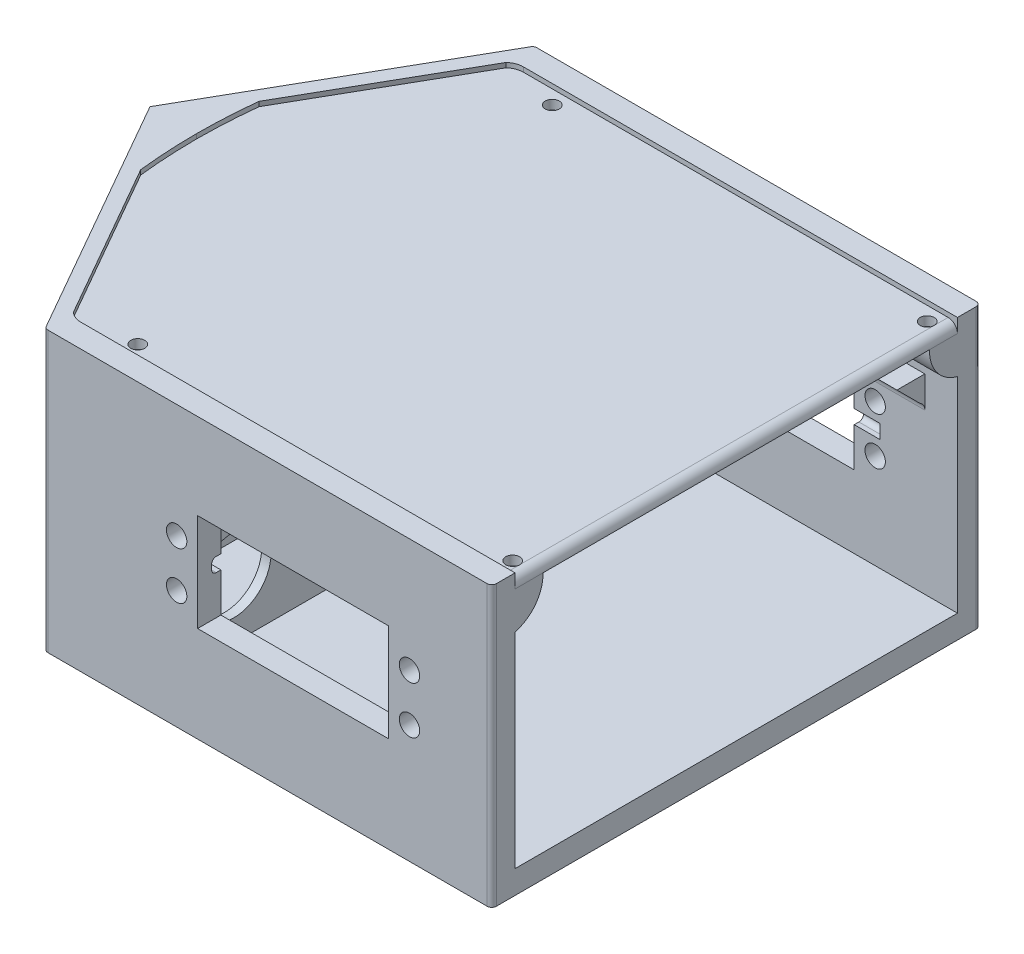
from build123d import *

# Parameters (mm, degrees)
SKETCH1_W                            = 130.89
SKETCH1_H                            = 105
OUTER_BLOCK_DEPTH                    = 60
SKETCH2_W                            = 95.885
SKETCH2_H                            = 95
MAINCAVITY_DEPTH                     = 55
SKETCH13_R                           = 2.25
MAGNET_HOLES_DEPTH                   = 5
CASTOR_START                         = -60
SKETCH16_W                           = 20.005
SKETCH16_H                           = 25.4
CASTOR_BOT_HOLLOW_DEPTH              = 3.937
SKETCH19_W                           = 20
SKETCH19_H                           = 25.4
CASTOR_TOP_HOLLOW_DEPTH              = 51.603
SKETCH20_R                           = 1.25
CASTOR_HOLES_DEPTH                   = 99.499581898
SKETCH51_W                           = 105
SKETCH51_H                           = 60
FRONT_CUTOUT_DEPTH                   = 5
SKETCH67_W                           = 72
SKETCH67_H                           = 6
BOARD_SHELF_DEPTH                    = 5
BOARD_SELF_ANGLE_SIZE                = 5
BOARD_SHELF_UNDER_FILLET_R           = 2
SERVO_START                          = 12.5
SKETCH50_R                           = 2.19
SKETCH50_W                           = 41
SKETCH50_H                           = 21
SERVO_HOLES_DEPTH                    = 138.955582158
BACK_TRIANGULIZATION_DEPTH           = 104.146972932
BACK_TRIANGLE_HOLLOWS_REACH          = 105.147
BACK_TRIANGLE_EDGE_FILLET_R          = 4
CASTER_TOP_HOLLOW_FILLET_R           = 121
OUSTIDE_ROUNDING_1_R                 = 1
OUTSIDE_ROUNDING_2_R                 = 1
SKETCH73_W                           = 7
SKETCH73_H                           = 6
SKETCH73_W_2                         = 10.022866576
TOPPLATE_SUPPORTS_DEPTH              = 8
SKETCH79_R                           = 1
TOP_PLATE_SUPPORT_HOLES_DEPTH        = 98.161196087
TOPPLATE_DEPTH                       = 2
TOPPLATE_BACK_FILLET_R               = 2
SKETCH78_R                           = 1.5
TOP_PLATE_HOLES_DEPTH                = 2
TOP_START                            = -28.577866576
TOP_PLATE_SUPPORT_FILLETS_DEPTH      = 89.577866576
SKETCH69_W                           = 11
SKETCH69_H                           = 3
SERVO_NOTCH_LEFT_DEPTH               = 2
SKETCH70_W                           = 11
SKETCH70_H                           = 3
SERVO_NOTCH_RIGHT_DEPTH              = 2
SERVO_NOTCH_FILLET_R                 = 1
CASTOR_INSIDE_PRINTING_FILLET_R      = 5
SKETCH75_W                           = 2
SKETCH75_H                           = 95
BATTERY_HOLDER_DEPTH                 = 25
BATTERY_HOLDER_LIGHTEN_REACH         = 109.525
SKETCH76_R                           = 8
SKETCH77_W                           = 2.843660499
SKETCH77_H                           = 10
BATTERY_HOLDER_LEFT_WALL_DEPTH       = 10
SKETCH68_R                           = 1.5
BOARD_MOUNT_HOLES_DEPTH              = 8
SKETCH62_R                           = 1.55
BACK_CONNECT_HOLE_DEPTH              = 138.506538117
BACK_START                           = 4
SKETCH63_R                           = 2.5
BACK_CONNECT_HOLE_COUNTER_SINK_DEPTH = 100.146972932
BACK_START_2                         = -4
BACK_CONNECT_HOLE_NUT_SINK_DEPTH     = 100.146972932


with BuildPart() as part:
    # Sketch1 → Outer Block (new body)
    with BuildSketch(Plane(origin=(0, 0, 0), x_dir=(1, 0, 0), z_dir=(0, 1, 0))):
        Rectangle(SKETCH1_W, SKETCH1_H)
    extrude(amount=OUTER_BLOCK_DEPTH)

    # Sketch2 → MainCavity (cut)
    with BuildSketch(Plane(origin=(0, 60, 0), x_dir=(1, 0, 0), z_dir=(0, 1, 0))):
        with Locations((12.5025, 0)):
            Rectangle(SKETCH2_W, SKETCH2_H)
    extrude(amount=-MAINCAVITY_DEPTH, mode=Mode.SUBTRACT)

    # Sketch13 → Magnet Holes (cut)
    with BuildSketch(Plane(origin=(12.125534159, 0, -8.523260096), x_dir=(1, 0, 0), z_dir=(0, -1, 0))):
        with Locations(Location((-12.125534159, -4.176739904, 0), (0, 0, 270))):
            Circle(SKETCH13_R)
        with Locations(Location((-12.125534159, 21.223260096, 0), (0, 0, 270))):
            Circle(SKETCH13_R)
    extrude(amount=-MAGNET_HOLES_DEPTH, mode=Mode.SUBTRACT)

    # Sketch16 → Castor Bot Hollow (cut)
    with BuildSketch(Plane(origin=(0, 60, 0), x_dir=(1, 0, 0), z_dir=(0, 1, 0)).offset(CASTOR_START)):
        with Locations((-45.4425, 0)):
            Rectangle(SKETCH16_W, SKETCH16_H)
    extrude(amount=CASTOR_BOT_HOLLOW_DEPTH, mode=Mode.SUBTRACT)

    # Sketch19 → Castor Top Hollow (cut)
    with BuildSketch(Plane(origin=(0, 60, -60), x_dir=(1, 0, 0), z_dir=(0, -1, 0))):
        with Locations((-45.44, 60)):
            Rectangle(SKETCH19_W, SKETCH19_H)
    extrude(amount=CASTOR_TOP_HOLLOW_DEPTH, mode=Mode.SUBTRACT)

    # Sketch20 → Castor Holes (cut, through all)
    with BuildSketch(Plane(origin=(0, 8.397, 0), x_dir=(1, 0, 0), z_dir=(0, 1, 0))):
        with Locations(Location((-45.44, -7.366, 0), (0, 0, 270))):
            Circle(SKETCH20_R)
        with Locations(Location((-45.44, 7.366, 0), (0, 0, 270))):
            Circle(SKETCH20_R)
    extrude(amount=-CASTOR_HOLES_DEPTH, mode=Mode.SUBTRACT)

    # Sketch51 → Front Cutout (cut)
    with BuildSketch(Plane(origin=(65.445, 0, 0), x_dir=(0, 0, -1), z_dir=(1, 0, 0))):
        with Locations((0, 30)):
            Rectangle(SKETCH51_W, SKETCH51_H)
    extrude(amount=-FRONT_CUTOUT_DEPTH, mode=Mode.SUBTRACT)

    # Sketch67 → Board Shelf (add)
    with BuildSketch(Plane(origin=(0, 46, 0), x_dir=(1, 0, 0), z_dir=(0, 1, 0))):
        with Locations((17.445, 44.5)):
            Rectangle(SKETCH67_W, SKETCH67_H)
        with Locations((17.445, -44.5)):
            Rectangle(SKETCH67_W, SKETCH67_H)
    extrude(amount=-BOARD_SHELF_DEPTH)

    # Board Self Angle
    board_self_angle_edges = [part.edges().sort_by_distance(p)[0] for p in [
        (17.445, 41, -41.5),
        (17.445, 41, 41.5),
    ]]
    chamfer(board_self_angle_edges, length=BOARD_SELF_ANGLE_SIZE - 0.0001)  # a hair under: the kernel refuses the full size

    # Board Shelf Under Fillet
    # the kernel refuses this fillet: 2 mm, written as the material it adds along each edge
    with BuildSketch(Plane(origin=(-18.555, 41, 47.5), x_dir=(0, -1, 0), z_dir=(1, 0, 0))) as board_shelf_under_fillet_piece_1:
        with BuildLine():
            CenterArc((1.732108539, 2), BOARD_SHELF_UNDER_FILLET_R, 209.996692082, 60.003307918)
            Line((0, 1.0001), (0, 0))
            Line((0, 0), (1.732108539, 0))
        make_face()
    extrude(amount=72)
    with BuildSketch(Plane(origin=(-18.555, 41, -47.5), x_dir=(0, 0, 1), z_dir=(1, 0, 0))) as board_shelf_under_fillet_piece_2:
        with BuildLine():
            CenterArc((2, 1.732108539), BOARD_SHELF_UNDER_FILLET_R, 180, 60.003307918)
            Line((0, 1.732108539), (0, 0))
            Line((0, 0), (1.0001, 0))
        make_face()
    extrude(amount=72)

    # Sketch50 → Servo Holes (cut, through all)
    with BuildSketch(Plane(origin=(12.125534159, 34.141841264, 40), x_dir=(1, 0, 0), z_dir=(0, 0, 1)).offset(SERVO_START)):
        with Locations((30.654465841, 1.418158736)):
            Circle(SKETCH50_R)
        with Locations((30.654465841, -8.751841264)):
            Circle(SKETCH50_R)
        with Locations((-19.345534159, -8.751841264)):
            Circle(SKETCH50_R)
        with Locations((-19.345534159, 1.418158736)):
            Circle(SKETCH50_R)
        with Locations((5.654465841, -3.076841264)):
            Rectangle(SKETCH50_W, SKETCH50_H)
    extrude(amount=-SERVO_HOLES_DEPTH, mode=Mode.SUBTRACT)

    # Sketch54 → Back Triangulization (cut, through all)
    with BuildSketch(Plane(origin=(0, 60, 0), x_dir=(1, 0, 0), z_dir=(0, 1, 0))):
        Polygon((-35.44, -52.5), (-65.445, 0), (-65.445, -52.5), align=None)
        Polygon((-65.445, 52.5), (-65.445, 0), (-35.44, 52.5), align=None)
    extrude(amount=-BACK_TRIANGULIZATION_DEPTH, mode=Mode.SUBTRACT)

    # Back Triangle Hollows: up to this face of the body (flat: up to its plane)
    back_triangle_hollows_end = Plane(part.part.faces().sort_by_distance((12.546311355, 5, 0))[0])
    # Sketch55 → Back Triangle Hollows (cut, up to the picked face)
    with BuildSketch(Plane(origin=(0, 60, 0), x_dir=(1, 0, 0), z_dir=(0, 1, 0)), mode=Mode.PRIVATE) as back_triangle_hollows_sk1:
        Polygon((-54.731252535, 12.7), (-34.842223964, 47.5), (-34.842223964, 12.7), align=None)
    back_triangle_hollows_tool1 = split(extrude(back_triangle_hollows_sk1.sketch, amount=-BACK_TRIANGLE_HOLLOWS_REACH, mode=Mode.PRIVATE), bisect_by=back_triangle_hollows_end, keep=Keep.BOTH, mode=Mode.PRIVATE)
    # Sketch55 → Back Triangle Hollows (cut, up to the picked face)
    with BuildSketch(Plane(origin=(0, 60, 0), x_dir=(1, 0, 0), z_dir=(0, 1, 0)), mode=Mode.PRIVATE) as back_triangle_hollows_sk2:
        Polygon((-34.842223964, -47.5), (-54.731252535, -12.7), (-34.842223964, -12.7), align=None)
    back_triangle_hollows_tool2 = split(extrude(back_triangle_hollows_sk2.sketch, amount=-BACK_TRIANGLE_HOLLOWS_REACH, mode=Mode.PRIVATE), bisect_by=back_triangle_hollows_end, keep=Keep.BOTH, mode=Mode.PRIVATE)
    add(back_triangle_hollows_tool1.solids().sort_by(Axis((-41.4719, 60, -24.3), (0, -1, 0)))[0], mode=Mode.SUBTRACT)
    add(back_triangle_hollows_tool2.solids().sort_by(Axis((-41.4719, 60, 24.3), (0, -1, 0)))[0], mode=Mode.SUBTRACT)

    # Back Triangle Edge Fillet
    # the kernel refuses this fillet: 4 mm, written as the material it adds along each edge
    with BuildSketch(Plane(origin=(-35.44, 60, 47.5), x_dir=(1, 0, 0), z_dir=(0, -1, 0))) as back_triangle_edge_fillet_piece_1:
        with BuildLine():
            CenterArc((2.69694133, -4), BACK_TRIANGLE_EDGE_FILLET_R, 90, 42.394797492)
            Line((0, -1.045933741), (0, 0))
            Line((0, 0), (2.69694133, 0))
        make_face()
    extrude(amount=55)
    with BuildSketch(Plane(origin=(-35.44, 60, -47.5), x_dir=(1, 0, 0), z_dir=(0, -1, 0))) as back_triangle_edge_fillet_piece_2:
        with BuildLine():
            CenterArc((2.69694133, 4), BACK_TRIANGLE_EDGE_FILLET_R, 227.605202508, 42.394797492)
            Line((0, 1.045933741), (0, 0))
            Line((0, 0), (2.69694133, 0))
        make_face()
    extrude(amount=55)

    # Caster Top Hollow Fillet
    # the kernel refuses this fillet: 121 mm, written as the material it adds along each edge
    with BuildSketch(Plane(origin=(-55.44, 60, 12.7), x_dir=(1, 0, 0), z_dir=(0, -1, 0))) as caster_top_hollow_fillet_piece_1_section:
        with BuildLine():
            CenterArc((121, -13.077253666), CASTER_TOP_HOLLOW_FILLET_R, 173.795555283, 6.204444717)
            Line((0, -13.077253666), (0, 0))
            Line((0, 0), (0.708747465, 0))
        make_face()
    caster_top_hollow_fillet_piece_1 = extrude(amount=84.296134165, mode=Mode.PRIVATE)
    caster_top_hollow_fillet_piece_1 = split(caster_top_hollow_fillet_piece_1, bisect_by=Plane(origin=(-55.44, 3.937, 12.7), z_dir=(0, 1, 0)), keep=Keep.TOP, mode=Mode.PRIVATE)
    add(caster_top_hollow_fillet_piece_1)
    with BuildSketch(Plane(origin=(-55.44, 60, -12.7), x_dir=(1, 0, 0), z_dir=(0, -1, 0))) as caster_top_hollow_fillet_piece_2_section:
        with BuildLine():
            CenterArc((121, 13.077253666), CASTER_TOP_HOLLOW_FILLET_R, 180, 6.204444717)
            Line((0, 13.077253666), (0, 0))
            Line((0, 0), (0.708747465, 0))
        make_face()
    caster_top_hollow_fillet_piece_2 = extrude(amount=84.296134165, mode=Mode.PRIVATE)
    caster_top_hollow_fillet_piece_2 = split(caster_top_hollow_fillet_piece_2, bisect_by=Plane(origin=(-55.44, 3.937, -12.7), z_dir=(0, 1, 0)), keep=Keep.TOP, mode=Mode.PRIVATE)
    add(caster_top_hollow_fillet_piece_2)

    # Oustide Rounding 1
    oustide_rounding_1_edges = [part.edges().sort_by_distance(p)[0] for p in [
        (-35.44, 30, 52.5),
        (60.445, 30, 52.5),
    ]]
    fillet(oustide_rounding_1_edges, radius=OUSTIDE_ROUNDING_1_R)

    # Outside Rounding 2
    outside_rounding_2_edges = [part.edges().sort_by_distance(p)[0] for p in [
        (-35.44, 30, -52.5),
        (60.445, 30, -52.5),
    ]]
    fillet(outside_rounding_2_edges, radius=OUTSIDE_ROUNDING_2_R)

    # Sketch73 → TopPlate Supports (add)
    with BuildSketch(Plane(origin=(0, 57, 0), x_dir=(1, 0, 0), z_dir=(0, 1, 0))):
        with Locations((56.945, 44.5)):
            Rectangle(SKETCH73_W, SKETCH73_H)
        with Locations((56.945, -44.5)):
            Rectangle(SKETCH73_W, SKETCH73_H)
        with Locations((-23.566433288, -44.5)):
            Rectangle(SKETCH73_W_2, SKETCH73_H)
        with Locations((-23.566433288, 44.5)):
            Rectangle(SKETCH73_W_2, SKETCH73_H)
    extrude(amount=-TOPPLATE_SUPPORTS_DEPTH)

    # Sketch79 → Top Plate Support Holes (cut, through all)
    with BuildSketch(Plane(origin=(0, 49, 0), x_dir=(1, 0, 0), z_dir=(0, 1, 0))):
        with Locations(Location((-23.566433288, 44.5, 0), (0, 0, 90))):
            Circle(SKETCH79_R)
        with Locations(Location((56.945, 44.5, 0), (0, 0, 90))):
            Circle(SKETCH79_R)
        with Locations(Location((-23.566433288, -44.5, 0), (0, 0, 270))):
            Circle(SKETCH79_R)
        with Locations(Location((56.945, -44.5, 0), (0, 0, 270))):
            Circle(SKETCH79_R)
    extrude(amount=TOP_PLATE_SUPPORT_HOLES_DEPTH, mode=Mode.SUBTRACT)

    # Top Plate Support Fillets: read off the stored shape, not the designer's step
    # Top Plate Support Fillets outline → Top Plate Support Fillets (cut)
    with BuildSketch(Plane.YZ.offset(TOP_START)):
        with BuildLine():
            ThreePointArc((49, -47.5), (51.846987207, -43.17544468), (56.745966692, -41.5))
            Line((56.745966692, -41.5), (49, -41.5))
            Line((49, -41.5), (49, -47.5))
        make_face()
        with BuildLine():
            ThreePointArc((56.745966692, 41.5), (51.846987207, 43.17544468), (49, 47.5))
            Line((49, 47.5), (49, 41.5))
            Line((49, 41.5), (56.745966692, 41.5))
        make_face()
    extrude(amount=TOP_PLATE_SUPPORT_FILLETS_DEPTH, mode=Mode.SUBTRACT)

    # Sketch69 → Servo Notch Left (cut)
    with BuildSketch(Plane.XY.offset(-47.5)):
        with Locations((38.28, 30.475)):
            Rectangle(SKETCH69_W, SKETCH69_H)
        with Locations((-2.72, 30.475)):
            Rectangle(SKETCH69_W, SKETCH69_H)
    extrude(amount=-SERVO_NOTCH_LEFT_DEPTH, mode=Mode.SUBTRACT)

    # Sketch70 → Servo Notch Right (cut)
    with BuildSketch(Plane(origin=(0, 0, 47.5), x_dir=(-1, 0, 0), z_dir=(0, 0, -1))):
        with Locations((2.72, 30.475)):
            Rectangle(SKETCH70_W, SKETCH70_H)
        with Locations((-38.28, 30.475)):
            Rectangle(SKETCH70_W, SKETCH70_H)
    extrude(amount=-SERVO_NOTCH_RIGHT_DEPTH, mode=Mode.SUBTRACT)

    # Servo Notch Fillet
    servo_notch_fillet_edges = [part.edges().sort_by_distance(p)[0] for p in [
        (41.03, 28.975, -49.5),
        (41.03, 31.975, -49.5),
        (-5.47, 31.975, -49.5),
        (-5.47, 28.975, -49.5),
        (-5.47, 31.975, 49.5),
        (-5.47, 28.975, 49.5),
        (41.03, 31.975, 49.5),
        (41.03, 28.975, 49.5),
    ]]
    fillet(servo_notch_fillet_edges, radius=SERVO_NOTCH_FILLET_R)

    # Castor Inside Printing Fillet
    # the kernel refuses this fillet: 5 mm, written as the material it adds along each edge
    with BuildSketch(Plane(origin=(-35.44, 5, 12.7), x_dir=(0, 0, 1), z_dir=(-1, 0, 0))) as castor_inside_printing_fillet_piece_1_section:
        with BuildLine():
            CenterArc((4.736073374, 5), CASTOR_INSIDE_PRINTING_FILLET_R, 198.699214215, 71.300785785)
            Line((0, 3.397), (-0.094721467, 3.36494))
            ThreePointArc((-0.094721467, 3.36494), (-0.1, 1.6985), (-0.1, 0))
            Line((-0.1, 0), (0, -0.1))
            Line((0, -0.1), (4.736073374, -0.1))
            Line((4.736073374, -0.1), (4.736073374, 0))
        make_face()
    castor_inside_printing_fillet_piece_1 = extrude(amount=31.131435969, mode=Mode.PRIVATE)
    castor_inside_printing_fillet_piece_1 = split(castor_inside_printing_fillet_piece_1, bisect_by=Plane(origin=(-49.981443283, 5, 21.010781061), z_dir=(0.8682075211168646, 0, -0.4962012699259336)), keep=Keep.TOP, mode=Mode.PRIVATE)
    add(castor_inside_printing_fillet_piece_1)
    with BuildSketch(Plane(origin=(-66.571435969, 5, -12.7), x_dir=(0, 0, -1), z_dir=(1, 0, 0))) as castor_inside_printing_fillet_piece_2_section:
        with BuildLine():
            CenterArc((4.736073374, 5), CASTOR_INSIDE_PRINTING_FILLET_R, 198.699214215, 71.300785785)
            Line((0, 3.397), (-0.094721467, 3.36494))
            ThreePointArc((-0.094721467, 3.36494), (-0.1, 1.6985), (-0.1, 0))
            Line((-0.1, 0), (0, -0.1))
            Line((0, -0.1), (4.736073374, -0.1))
            Line((4.736073374, -0.1), (4.736073374, 0))
        make_face()
    castor_inside_printing_fillet_piece_2 = extrude(amount=31.131435969, mode=Mode.PRIVATE)
    castor_inside_printing_fillet_piece_2 = split(castor_inside_printing_fillet_piece_2, bisect_by=Plane(origin=(-57.646491591, 5, -7.599181789), z_dir=(0.8682075211168648, 0, 0.4962012699259331)), keep=Keep.TOP, mode=Mode.PRIVATE)
    add(castor_inside_printing_fillet_piece_2)
    with BuildSketch(Plane(origin=(-35.44, 5, 12.7), x_dir=(1, 0, 0), z_dir=(0, 0, -1))) as castor_inside_printing_fillet_piece_3:
        with BuildLine():
            CenterArc((4.736073374, -5), CASTOR_INSIDE_PRINTING_FILLET_R, 90, 71.300785785)
            Line((0, -3.397), (-0.094721467, -3.36494))
            ThreePointArc((-0.094721467, -3.36494), (-0.1, -1.6985), (-0.1, 0))
            Line((-0.1, 0), (0, 0.1))
            Line((0, 0.1), (4.736073374, 0.1))
            Line((4.736073374, 0.1), (4.736073374, 0))
        make_face()
    extrude(amount=25.4)
    with BuildSketch(Plane(origin=(-35.44, 5, 24.540183434), x_dir=(1, 0, 0), z_dir=(0, 0, -1))) as castor_inside_printing_fillet_piece_4a_section:
        with BuildLine():
            CenterArc((4.736073374, -5), CASTOR_INSIDE_PRINTING_FILLET_R, 90, 71.300785785)
            Line((0, -3.397), (-0.094721467, -3.36494))
            ThreePointArc((-0.094721467, -3.36494), (-0.1, -1.6985), (-0.1, 0))
            Line((-0.1, 0), (0, 0.1))
            Line((0, 0.1), (4.736073374, 0.1))
            Line((4.736073374, 0.1), (4.736073374, 0))
        make_face()
    castor_inside_printing_fillet_piece_4a = extrude(amount=37.240183434, mode=Mode.PRIVATE)
    castor_inside_printing_fillet_piece_4a = split(castor_inside_printing_fillet_piece_4a, bisect_by=Plane(origin=(-35.44, 5, 12.7), z_dir=(0, 0, 1)), keep=Keep.TOP, mode=Mode.PRIVATE)
    with BuildSketch(Plane(origin=(-23.599816566, 5, 12.7), x_dir=(0, 0, 1), z_dir=(-1, 0, 0))) as castor_inside_printing_fillet_piece_4b_section:
        with BuildLine():
            CenterArc((4.736073374, 5), CASTOR_INSIDE_PRINTING_FILLET_R, 198.699214215, 71.300785785)
            Line((0, 3.397), (-0.094721467, 3.36494))
            ThreePointArc((-0.094721467, 3.36494), (-0.1, 1.6985), (-0.1, 0))
            Line((-0.1, 0), (0, -0.1))
            Line((0, -0.1), (4.736073374, -0.1))
            Line((4.736073374, -0.1), (4.736073374, 0))
        make_face()
    castor_inside_printing_fillet_piece_4b = extrude(amount=42.971619403, mode=Mode.PRIVATE)
    castor_inside_printing_fillet_piece_4b = split(castor_inside_printing_fillet_piece_4b, bisect_by=Plane(origin=(-35.44, 5, 12.7), z_dir=(1, 0, 0)), keep=Keep.TOP, mode=Mode.PRIVATE)
    castor_inside_printing_fillet_piece_4 = castor_inside_printing_fillet_piece_4a & castor_inside_printing_fillet_piece_4b
    add(castor_inside_printing_fillet_piece_4)
    with BuildSketch(Plane(origin=(-66.571435969, 5, -12.7), x_dir=(0, 0, -1), z_dir=(1, 0, 0))) as castor_inside_printing_fillet_piece_5a_section:
        with BuildLine():
            CenterArc((4.736073374, 5), CASTOR_INSIDE_PRINTING_FILLET_R, 198.699214215, 71.300785785)
            Line((0, 3.397), (-0.094721467, 3.36494))
            ThreePointArc((-0.094721467, 3.36494), (-0.1, 1.6985), (-0.1, 0))
            Line((-0.1, 0), (0, -0.1))
            Line((0, -0.1), (4.736073374, -0.1))
            Line((4.736073374, -0.1), (4.736073374, 0))
        make_face()
    castor_inside_printing_fillet_piece_5a = extrude(amount=42.971619403, mode=Mode.PRIVATE)
    castor_inside_printing_fillet_piece_5a = split(castor_inside_printing_fillet_piece_5a, bisect_by=Plane(origin=(-35.44, 5, -12.7), z_dir=(1, 0, 0)), keep=Keep.TOP, mode=Mode.PRIVATE)
    with BuildSketch(Plane(origin=(-35.44, 5, 12.7), x_dir=(1, 0, 0), z_dir=(0, 0, -1))) as castor_inside_printing_fillet_piece_5b_section:
        with BuildLine():
            CenterArc((4.736073374, -5), CASTOR_INSIDE_PRINTING_FILLET_R, 90, 71.300785785)
            Line((0, -3.397), (-0.094721467, -3.36494))
            ThreePointArc((-0.094721467, -3.36494), (-0.1, -1.6985), (-0.1, 0))
            Line((-0.1, 0), (0, 0.1))
            Line((0, 0.1), (4.736073374, 0.1))
            Line((4.736073374, 0.1), (4.736073374, 0))
        make_face()
    castor_inside_printing_fillet_piece_5b = extrude(amount=37.240183434, mode=Mode.PRIVATE)
    castor_inside_printing_fillet_piece_5b = split(castor_inside_printing_fillet_piece_5b, bisect_by=Plane(origin=(-35.44, 5, -12.7), z_dir=(0, 0, -1)), keep=Keep.TOP, mode=Mode.PRIVATE)
    castor_inside_printing_fillet_piece_5 = castor_inside_printing_fillet_piece_5a & castor_inside_printing_fillet_piece_5b
    add(castor_inside_printing_fillet_piece_5)

    # Sketch75 → Battery Holder (add)
    with BuildSketch(Plane(origin=(0, 5, 0), x_dir=(1, 0, 0), z_dir=(0, 1, 0))):
        with Locations((-31.703926626, 0)):
            Rectangle(SKETCH75_W, SKETCH75_H)
        with Locations((-12.703926626, 0)):
            Rectangle(SKETCH75_W, SKETCH75_H)
    extrude(amount=BATTERY_HOLDER_DEPTH)

    # Battery Holder Lighten: up to this face of the body (flat: up to its plane)
    battery_holder_lighten_end = Plane(part.part.faces().sort_by_distance((-32.703926626, 17.569938244, 0))[0])
    # Sketch76 → Battery Holder Lighten (cut, up to the picked face)
    with BuildSketch(Plane(origin=(-11.703926626, 0, 0), x_dir=(0, 0, -1), z_dir=(1, 0, 0)), mode=Mode.PRIVATE) as battery_holder_lighten_sk1:
        with Locations((-35.747222349, 17.673616725)):
            Circle(SKETCH76_R)
    battery_holder_lighten_tool1 = split(extrude(battery_holder_lighten_sk1.sketch, amount=-BATTERY_HOLDER_LIGHTEN_REACH, mode=Mode.PRIVATE), bisect_by=battery_holder_lighten_end, keep=Keep.BOTH, mode=Mode.PRIVATE)
    # Sketch76 → Battery Holder Lighten (cut, up to the picked face)
    with BuildSketch(Plane(origin=(-11.703926626, 0, 0), x_dir=(0, 0, -1), z_dir=(1, 0, 0)), mode=Mode.PRIVATE) as battery_holder_lighten_sk2:
        with Locations((-11.747222349, 17.673616725)):
            Circle(SKETCH76_R)
    battery_holder_lighten_tool2 = split(extrude(battery_holder_lighten_sk2.sketch, amount=-BATTERY_HOLDER_LIGHTEN_REACH, mode=Mode.PRIVATE), bisect_by=battery_holder_lighten_end, keep=Keep.BOTH, mode=Mode.PRIVATE)
    # Sketch76 → Battery Holder Lighten (cut, up to the picked face)
    with BuildSketch(Plane(origin=(-11.703926626, 0, 0), x_dir=(0, 0, -1), z_dir=(1, 0, 0)), mode=Mode.PRIVATE) as battery_holder_lighten_sk3:
        with Locations((12.252777651, 17.673616725)):
            Circle(SKETCH76_R)
    battery_holder_lighten_tool3 = split(extrude(battery_holder_lighten_sk3.sketch, amount=-BATTERY_HOLDER_LIGHTEN_REACH, mode=Mode.PRIVATE), bisect_by=battery_holder_lighten_end, keep=Keep.BOTH, mode=Mode.PRIVATE)
    # Sketch76 → Battery Holder Lighten (cut, up to the picked face)
    with BuildSketch(Plane(origin=(-11.703926626, 0, 0), x_dir=(0, 0, -1), z_dir=(1, 0, 0)), mode=Mode.PRIVATE) as battery_holder_lighten_sk4:
        with Locations((36.252777651, 17.673616725)):
            Circle(SKETCH76_R)
    battery_holder_lighten_tool4 = split(extrude(battery_holder_lighten_sk4.sketch, amount=-BATTERY_HOLDER_LIGHTEN_REACH, mode=Mode.PRIVATE), bisect_by=battery_holder_lighten_end, keep=Keep.BOTH, mode=Mode.PRIVATE)
    add(battery_holder_lighten_tool1.solids().sort_by(Axis((-11.703927, 17.673617, 35.747222), (-1, 0, 0)))[0], mode=Mode.SUBTRACT)
    add(battery_holder_lighten_tool2.solids().sort_by(Axis((-11.703927, 17.673617, 11.747222), (-1, 0, 0)))[0], mode=Mode.SUBTRACT)
    add(battery_holder_lighten_tool3.solids().sort_by(Axis((-11.703927, 17.673617, -12.252778), (-1, 0, 0)))[0], mode=Mode.SUBTRACT)
    add(battery_holder_lighten_tool4.solids().sort_by(Axis((-11.703927, 17.673617, -36.252778), (-1, 0, 0)))[0], mode=Mode.SUBTRACT)

    # Sketch77 → Battery Holder Left Wall (add)
    with BuildSketch(Plane(origin=(0, 5, 0), x_dir=(1, 0, 0), z_dir=(0, 1, 0))):
        with Locations((-22.708318133, -42.5)):
            Rectangle(SKETCH77_W, SKETCH77_H)
    extrude(amount=BATTERY_HOLDER_LEFT_WALL_DEPTH)

    # Sketch68 → Board Mount Holes (cut)
    with BuildSketch(Plane(origin=(0, 46, 0), x_dir=(1, 0, 0), z_dir=(0, 1, 0))):
        with Locations(Location((-10.555, 44.5, 0), (0, 0, 270))):
            Circle(SKETCH68_R)
        with Locations(Location((45.445, 44.5, 0), (0, 0, 270))):
            Circle(SKETCH68_R)
        with Locations(Location((45.445, -44.5, 0), (0, 0, 270))):
            Circle(SKETCH68_R)
        with Locations(Location((-10.555, -44.5, 0), (0, 0, 270))):
            Circle(SKETCH68_R)
    extrude(amount=-BOARD_MOUNT_HOLES_DEPTH, mode=Mode.SUBTRACT)

    # Sketch62 → Back Connect Hole (cut, through all)
    with BuildSketch(Plane(origin=(0, 0, -52.5), x_dir=(-1, 0, 0), z_dir=(0, 0, -1))):
        with Locations((60.445, 50)):
            Circle(SKETCH62_R)
    extrude(amount=-BACK_CONNECT_HOLE_DEPTH, mode=Mode.SUBTRACT)

    # Sketch63 → Back Connect Hole Counter Sink (cut, through all)
    with BuildSketch(Plane(origin=(0, 0, 0), x_dir=(-1, 0, 0), z_dir=(0, 0, -1)).offset(BACK_START)):
        with Locations((60.445, 50)):
            Circle(SKETCH63_R)
    extrude(amount=BACK_CONNECT_HOLE_COUNTER_SINK_DEPTH, mode=Mode.SUBTRACT)

    # Sketch64 → Back Connect Hole Nut Sink (cut, through all)
    with BuildSketch(Plane(origin=(0, 0, 0), x_dir=(-1, 0, 0), z_dir=(0, 0, -1)).offset(BACK_START_2)):
        Polygon((60.445, 46.535898385), (63.445, 48.267949192), (63.445, 51.732050808), (60.445, 53.464101615), (57.445, 51.732050808), (57.445, 48.267949192), align=None)
    extrude(amount=-BACK_CONNECT_HOLE_NUT_SINK_DEPTH, mode=Mode.SUBTRACT)


with BuildPart() as body_2:
    # Sketch72 → TopPlate (new body)
    with BuildSketch(Plane(origin=(0, 57, 0), x_dir=(1, 0, 0), z_dir=(0, 1, 0))):
        with BuildLine():
            Line((60.445, 47.5), (60.445, -47.5))
            Line((60.445, -47.5), (-32.74305867, -47.5))
            ThreePointArc((-32.74305867, -47.5), (-34.189387638, -47.229360873), (-35.44, -46.454066259))
            Line((-35.44, -46.454066259), (-54.731252535, -12.7))
            ThreePointArc((-54.731252535, -12.7), (-55.252328368, -6.359311802), (-55.439411898, 0))
            ThreePointArc((-55.439411898, 0), (-55.252328368, 6.359311802), (-54.731252535, 12.7))
            Line((-54.731252535, 12.7), (-35.44, 46.454066259))
            ThreePointArc((-35.44, 46.454066259), (-34.189387638, 47.229360873), (-32.74305867, 47.5))
            Line((-32.74305867, 47.5), (60.445, 47.5))
        make_face()
    extrude(amount=TOPPLATE_DEPTH)

    # TopPlate Back Fillet
    topplate_back_fillet_edges = [body_2.edges().sort_by_distance(p)[0] for p in [
        (60.445, 59, 0),
    ]]
    fillet(topplate_back_fillet_edges, radius=TOPPLATE_BACK_FILLET_R - 0.0001)  # a hair under: the kernel refuses the full size

    # Sketch78 → Top Plate Holes (cut)
    with BuildSketch(Plane(origin=(0, 59, 0), x_dir=(1, 0, 0), z_dir=(0, 1, 0))):
        with Locations(Location((-23.566433288, 44.5, 0), (0, 0, 270))):
            Circle(SKETCH78_R)
        with Locations(Location((56.945, 44.5, 0), (0, 0, 270))):
            Circle(SKETCH78_R)
        with Locations(Location((56.945, -44.5, 0), (0, 0, 270))):
            Circle(SKETCH78_R)
        with Locations(Location((-23.566433288, -44.5, 0), (0, 0, 270))):
            Circle(SKETCH78_R)
    extrude(amount=-TOP_PLATE_HOLES_DEPTH, mode=Mode.SUBTRACT)


solid = Compound([part.part, body_2.part])
